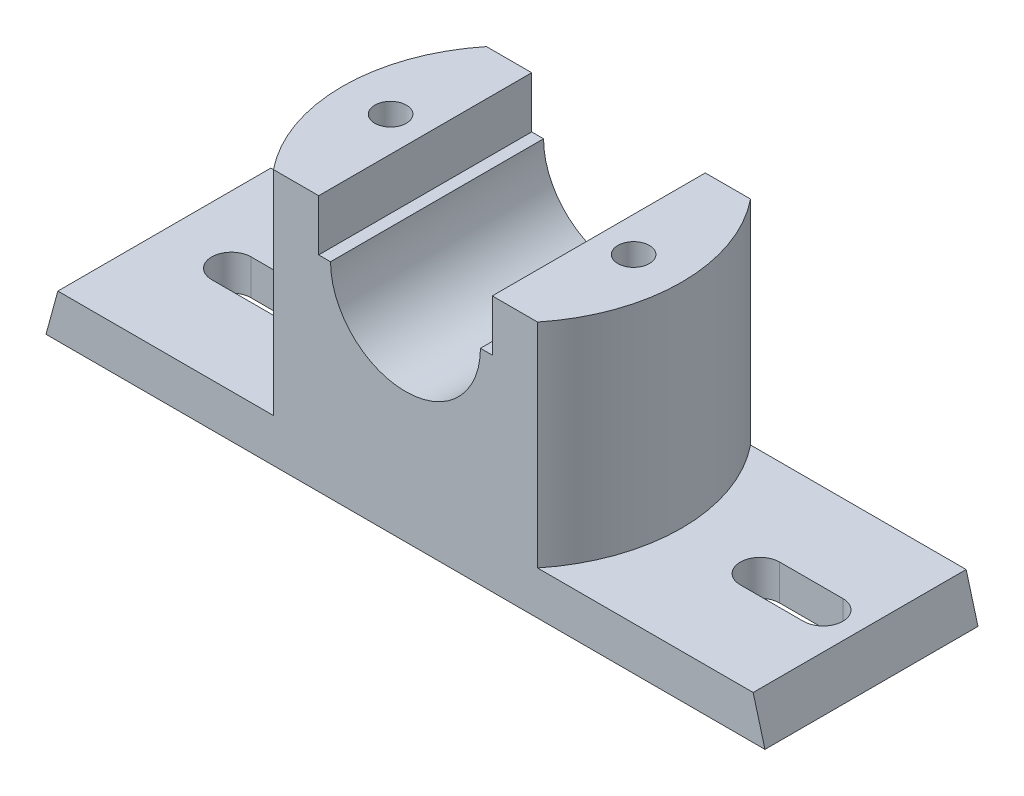
from build123d import *

# Parameters (mm, degrees)
BOSS_EXTRUDE1_DEPTH      = 54
BOSS_EXTRUDE2_DEPTH      = 54
CUT_EXTRUDE4_DEPTH       = 79.958686857
CUT_EXTRUDE8_DEPTH       = 120
CUT_EXTRUDE8_DEPTH_BACK  = 57
SKETCH4_R                = 4
CUT_EXTRUDE10_DEPTH      = 155
CUT_EXTRUDE10_DEPTH_BACK = 93
SKETCH5_R                = 4
CUT_EXTRUDE11_DEPTH      = 155
SKETCH7_W                = 62.578276035
SKETCH7_H                = 34.481752036
SKETCH7_W_2              = 74.024148658
SKETCH7_H_2              = 32.895468992
CUT_EXTRUDE12_DEPTH      = 2


with BuildPart() as part:
    # Sketch1 → Boss-Extrude1 (new body)
    with BuildSketch(Plane.XY):
        Polygon((-95, 0), (87.264140028, 0), (84.264140028, 11), (-92, 11), align=None)
    extrude(amount=BOSS_EXTRUDE1_DEPTH)

    # Sketch2 → Boss-Extrude2 (add)
    with BuildSketch(Plane(origin=(0, 11, 0), x_dir=(1, 0, 0), z_dir=(0, 1, 0))):
        with BuildLine():
            Line((-37.334331048, -54), (29.598471075, -54))
            ThreePointArc((29.598471075, -54), (36.678680511, -41.3168564), (39.132070014, -27))
            ThreePointArc((39.132070014, -27), (36.678680511, -12.6831436), (29.598471075, 0))
            Line((29.598471075, 0), (-37.334331048, 0))
            ThreePointArc((-37.334331048, 0), (-46.867929986, -27), (-37.334331048, -54))
        make_face()
    extrude(amount=BOSS_EXTRUDE2_DEPTH)

    # Sketch3 → Cut-Extrude4 (cut, symmetric)
    with BuildSketch(Plane.XY):
        with BuildLine():
            Line((15.132070014, 52), (18.132070014, 52))
            Line((18.132070014, 52), (18.132070014, 65))
            Line((18.132070014, 65), (-25.867929986, 65))
            Line((-25.867929986, 65), (-25.867929986, 52))
            Line((-25.867929986, 52), (-22.867929986, 52))
            ThreePointArc((-22.867929986, 52), (-3.867929986, 33), (15.132070014, 52))
        make_face()
    extrude(amount=CUT_EXTRUDE4_DEPTH, both=True, mode=Mode.SUBTRACT)

    # Sketch4 → Cut-Extrude8 (cut, two sides: drawn at the far end of the back side and taken through both)
    with BuildSketch(Plane(origin=(0, 0, 0), x_dir=(1, 0, 0), z_dir=(0, 1, 0)).offset(-CUT_EXTRUDE8_DEPTH_BACK)):
        with Locations((-34.646506606, -27)):
            Circle(SKETCH4_R)
    extrude(amount=CUT_EXTRUDE8_DEPTH + CUT_EXTRUDE8_DEPTH_BACK, mode=Mode.SUBTRACT)

    # Sketch5 → Cut-Extrude10 (cut, two sides: drawn at the far end of the back side and taken through both)
    with BuildSketch(Plane(origin=(0, 0, 0), x_dir=(1, 0, 0), z_dir=(0, 1, 0)).offset(-CUT_EXTRUDE10_DEPTH_BACK)):
        with Locations((26.963039677, -27)):
            Circle(SKETCH5_R)
    extrude(amount=CUT_EXTRUDE10_DEPTH + CUT_EXTRUDE10_DEPTH_BACK, mode=Mode.SUBTRACT)

    # Sketch6 → Cut-Extrude11 (cut)
    with BuildSketch(Plane(origin=(0, 11, 0), x_dir=(1, 0, 0), z_dir=(0, 1, 0))):
        with BuildLine():
            Line((75, -32), (59, -32))
            ThreePointArc((59, -32), (54, -27), (59, -22))
            Line((59, -22), (75, -22))
            ThreePointArc((75, -22), (80, -27), (75, -32))
        make_face()
        with BuildLine():
            Line((-59, -32), (-75, -32))
            ThreePointArc((-75, -32), (-80, -27), (-75, -22))
            Line((-75, -22), (-59, -22))
            ThreePointArc((-59, -22), (-54, -27), (-59, -32))
        make_face()
    extrude(amount=-CUT_EXTRUDE11_DEPTH, mode=Mode.SUBTRACT)

    # Sketch7 → Cut-Extrude12 (cut)
    with BuildSketch(Plane.XZ):
        with Locations((-52.436526345, 25.989630072)):
            Rectangle(SKETCH7_W, SKETCH7_H)
        with Locations((46.961370867, 26.782771594)):
            Rectangle(SKETCH7_W_2, SKETCH7_H_2)
    extrude(amount=-CUT_EXTRUDE12_DEPTH, mode=Mode.SUBTRACT)


solid = part.part
